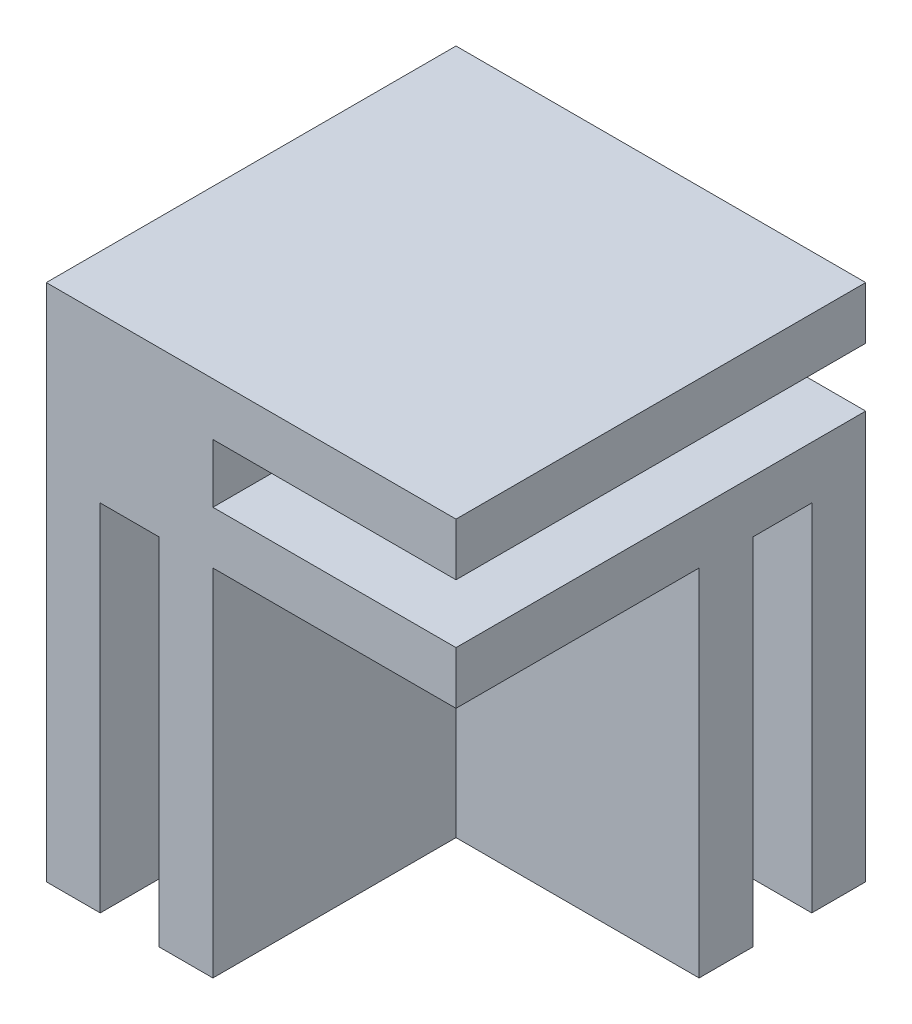
from build123d import *

# Parameters (mm, degrees)
ESQUISSE1_W             = 30
ESQUISSE1_H             = 30
BOSS_EXTRU_1_DEPTH      = 38
ESQUISSE2_W             = 17.8
ESQUISSE2_H             = 4.3
ESQUISSE2_W_2           = 4.3
ESQUISSE2_H_2           = 17.8
ENL_V_MAT_EXTRU_1_DEPTH = 26
ESQUISSE3_W             = 17.8
ESQUISSE3_H             = 4.3
ENL_V_MAT_EXTRU_3_DEPTH = 61.264898469


with BuildPart() as part:
    # Esquisse1 → Boss.-Extru.1 (new body)
    with BuildSketch(Plane(origin=(0, 0, 0), x_dir=(1, 0, 0), z_dir=(0, 1, 0))):
        with Locations((-20.886738322, -1.468531469)):
            Rectangle(ESQUISSE1_W, ESQUISSE1_H)
    extrude(amount=BOSS_EXTRU_1_DEPTH)

    # Esquisse2 → Enlèv. mat.-Extru.1 (cut)
    with BuildSketch(Plane.XZ):
        with Locations((-14.786738322, -7.431468531)):
            Rectangle(ESQUISSE2_W, ESQUISSE2_H)
        with Locations((-29.786738322, 7.568531469)):
            Rectangle(ESQUISSE2_W_2, ESQUISSE2_H_2)
        with Locations((-14.786738322, 7.568531469)):
            Rectangle(ESQUISSE2_W, ESQUISSE2_H_2)
    extrude(amount=-ENL_V_MAT_EXTRU_1_DEPTH, mode=Mode.SUBTRACT)

    # Esquisse3 → Enlèv. mat.-Extru.3 (cut, through all)
    with BuildSketch(Plane.XY.offset(16.468531469)):
        with Locations((-14.786738322, 32)):
            Rectangle(ESQUISSE3_W, ESQUISSE3_H)
    extrude(amount=-ENL_V_MAT_EXTRU_3_DEPTH, mode=Mode.SUBTRACT)


solid = part.part
